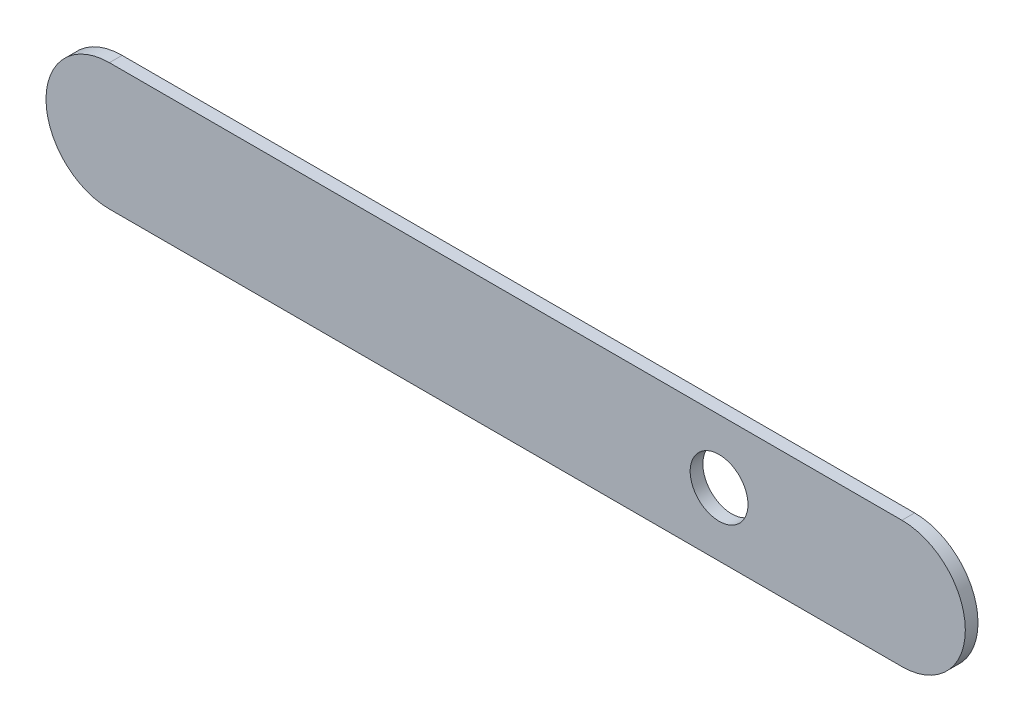
from build123d import *

# Parameters (mm, degrees)
SKETCH1_R           = 4.558097962
BOSS_EXTRUDE1_DEPTH = 1


with BuildPart() as part:
    # Sketch1 → Boss-Extrude1 (new, symmetric)
    with BuildSketch(Plane.XY):
        with BuildLine():
            Line((0, 10), (125, 10))
            ThreePointArc((125, 10), (135, 0), (125, -10))
            Line((125, -10), (0, -10))
            ThreePointArc((0, -10), (-10, 0), (0, 10))
        make_face()
        with Locations((96.159048976, 0)):
            Circle(SKETCH1_R, mode=Mode.SUBTRACT)
    extrude(amount=BOSS_EXTRUDE1_DEPTH, both=True)


solid = part.part
